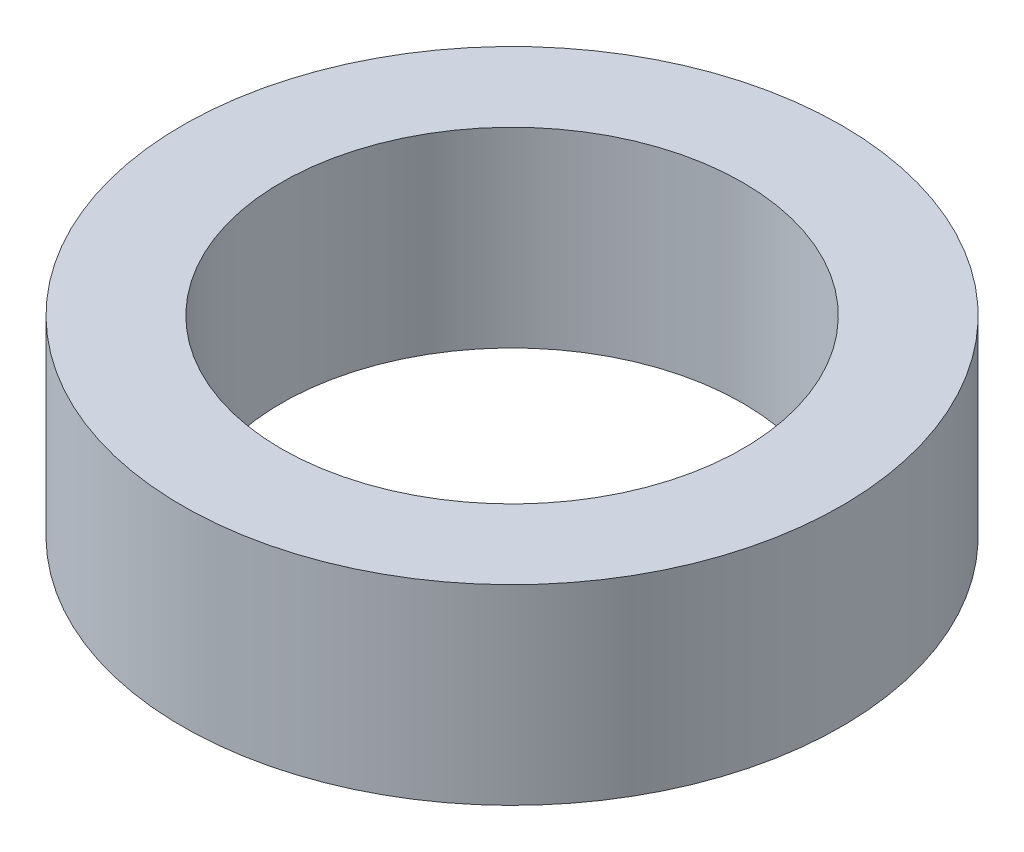
from build123d import *

# Parameters (mm, degrees)
SKETCH1_R           = 50
BOSS_EXTRUDE1_DEPTH = 29
SKETCH2_R           = 35
CUT_EXTRUDE1_DEPTH  = 77.426435217


with BuildPart() as part:
    # Sketch1 → Boss-Extrude1 (new body)
    with BuildSketch(Plane(origin=(0, 0, 0), x_dir=(1, 0, 0), z_dir=(0, 1, 0))):
        Circle(SKETCH1_R)
    extrude(amount=BOSS_EXTRUDE1_DEPTH)

    # Sketch2 → Cut-Extrude1 (cut, through all)
    with BuildSketch(Plane(origin=(0, 0, 0), x_dir=(1, 0, 0), z_dir=(0, 1, 0))):
        Circle(SKETCH2_R)
    extrude(amount=CUT_EXTRUDE1_DEPTH, mode=Mode.SUBTRACT)


solid = part.part
